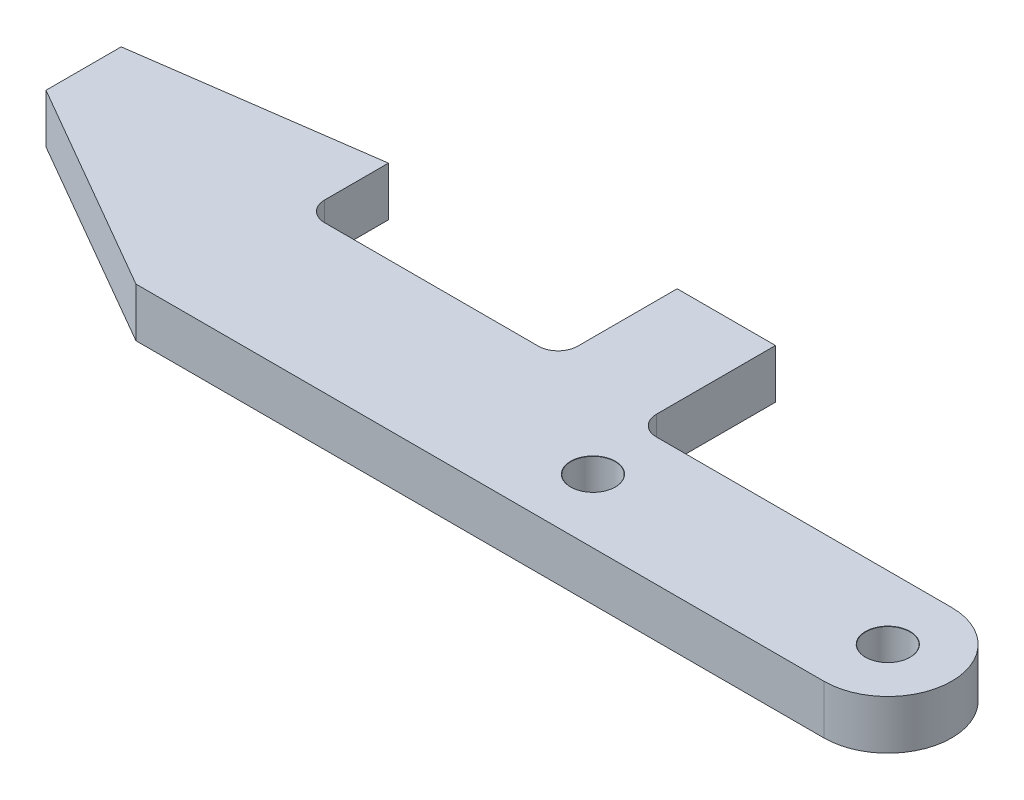
from build123d import *

# Parameters (mm, degrees)
BOSS_EXTRUDE1_DEPTH = 5
CUT_EXTRUDE1_DEPTH  = 64.006260456
FILLET2_R           = 2


# Read off the part's stored shape, not the designer's step: M4 Clearance Hole1
with BuildPart() as part:
    # Sketch1 → Boss-Extrude1 (new body)
    with BuildSketch(Plane(origin=(0, 0, 0), x_dir=(1, 0, 0), z_dir=(0, 1, 0))):
        with BuildLine():
            Line((-35, 0), (35, 0))
            ThreePointArc((35, 0), (41.5, 6.5), (35, 13))
            Line((35, 13), (2.949364905, 13))
            Line((2.949364905, 13), (2.949364905, 27.12))
            Line((2.949364905, 27.12), (-7.050635095, 27.12))
            Line((-7.050635095, 27.12), (-56.650635095, 20.149174599))
            Line((-56.650635095, 20.149174599), (-56.650635095, 12.5))
            Line((-56.650635095, 12.5), (-35, 0))
        make_face()
    extrude(amount=BOSS_EXTRUDE1_DEPTH)

    # M4 Clearance Hole1 outline → M4 Clearance Hole1 (revolve, cut)
    with BuildSketch(Plane(origin=(5, 0, -6.5), x_dir=(1, 0, 0), z_dir=(0, 0, 1))):
        Polygon((0, 0), (2.25, 0), (2.25, 4.979022509), (2.275, 5), (0, 5), align=None)
    revolve(axis=Axis((5, 0, -6.5), (0, 1, 0)), mode=Mode.SUBTRACT)

    # M4 Clearance Hole1 2 outline → M4 Clearance Hole1 2 (revolve, cut)
    with BuildSketch(Plane(origin=(35, 0, -6.5), x_dir=(1, 0, 0), z_dir=(0, 0, 1))):
        Polygon((0, 0), (2.25, 0), (2.25, 4.979022509), (2.275, 5), (0, 5), align=None)
    revolve(axis=Axis((35, 0, -6.5), (0, 1, 0)), mode=Mode.SUBTRACT)

    # Sketch4 → Cut-Extrude1 (cut, through all)
    with BuildSketch(Plane(origin=(0, 5, 0), x_dir=(1, 0, 0), z_dir=(0, 1, 0))):
        Polygon((-32.80827349, 23.5), (-7.050635095, 27.12), (-7.050635095, 15), (-32.80827349, 15), align=None)
    extrude(amount=-CUT_EXTRUDE1_DEPTH, mode=Mode.SUBTRACT)

    # Fillet2
    fillet2_edges = [part.edges().sort_by_distance(p)[0] for p in [
        (2.949364905, 2.5, -13),
        (-7.050635095, 2.5, -15),
        (-32.80827349, 2.5, -15),
    ]]
    fillet(fillet2_edges, radius=FILLET2_R)


solid = part.part
